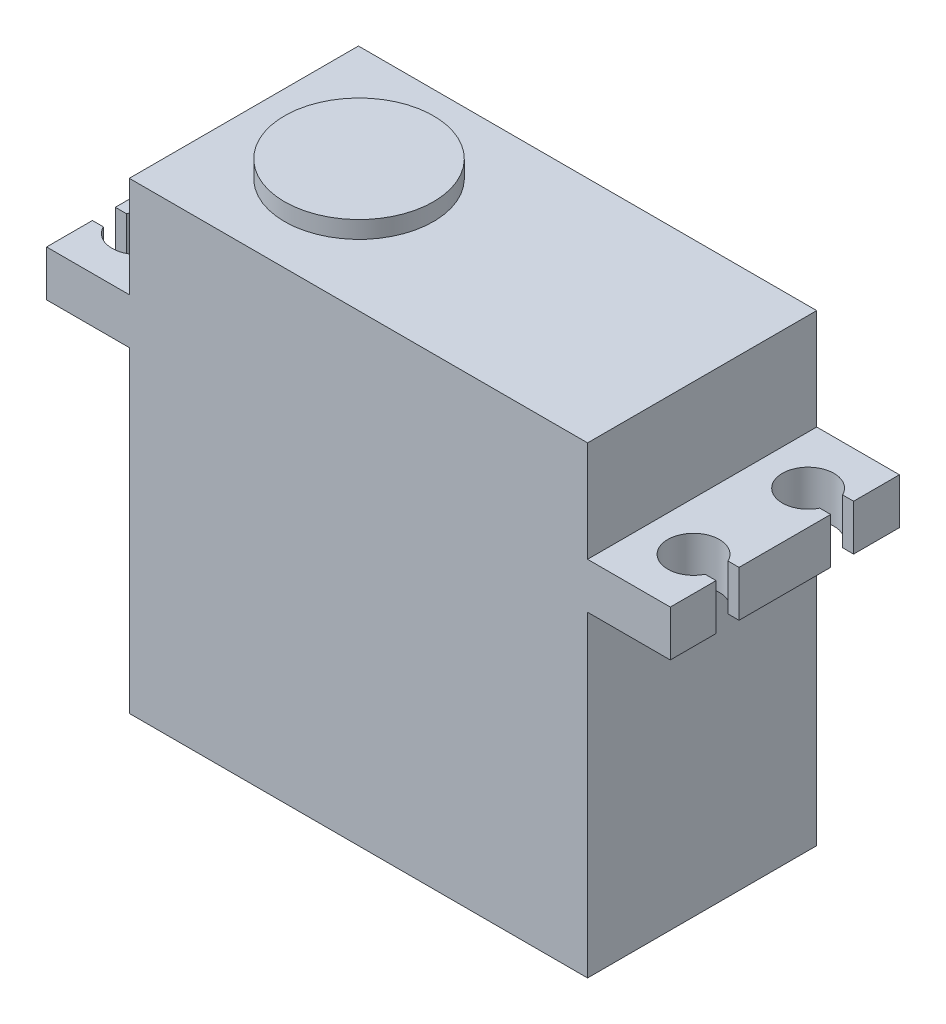
from build123d import *

# Parameters (mm, degrees)
SKETCH2_W             = 40
SKETCH2_H             = 20
BOSS_EXTRUDE1_DEPTH   = 27.65
SKETCH3_W             = 7
SKETCH3_H             = 4
BOSS_EXTRUDE2_DEPTH   = 5
SKETCH5_W             = 40
SKETCH5_H             = 20
BOSS_EXTRUDE5_DEPTH   = 12.8
SKETCH7_W             = 20
SKETCH7_H             = 4
BOSS_EXTRUDE6_DEPTH   = 7.22
CUT_EXTRUDE3_DEPTH    = 4
MIRROR11_COPY_1_DEPTH = 4
SKETCH9_R             = 6.5
BOSS_EXTRUDE8_DEPTH   = 1.5


with BuildPart() as part:
    # Sketch2 → Boss-Extrude1 (new body)
    with BuildSketch(Plane(origin=(0, 0, 0), x_dir=(1, 0, 0), z_dir=(0, 1, 0))):
        Rectangle(SKETCH2_W, SKETCH2_H)
    extrude(amount=BOSS_EXTRUDE1_DEPTH)

    # Sketch3 → Boss-Extrude2 (add)
    with BuildSketch(Plane.ZY.offset(20)):
        with Locations((0, 6)):
            Rectangle(SKETCH3_W, SKETCH3_H)
    extrude(amount=BOSS_EXTRUDE2_DEPTH)

    # Sketch5 → Boss-Extrude5 (add)
    with BuildSketch(Plane(origin=(0, 27.65, 0), x_dir=(1, 0, 0), z_dir=(0, 1, 0))):
        Rectangle(SKETCH5_W, SKETCH5_H)
    extrude(amount=BOSS_EXTRUDE5_DEPTH)

    # Sketch7 → Boss-Extrude6 (add)
    with BuildSketch(Plane.ZY.offset(20)):
        with Locations((0, 29.65)):
            Rectangle(SKETCH7_W, SKETCH7_H)
    boss_extrude6 = extrude(amount=BOSS_EXTRUDE6_DEPTH)

    # Sketch8 → Cut-Extrude3 (cut)
    with BuildSketch(Plane(origin=(0, 31.65, 0), x_dir=(1, 0, 0), z_dir=(0, 1, 0))):
        with BuildLine():
            Line((-26.265564437, 6), (-27.22, 6))
            Line((-27.22, 6), (-27.22, 4))
            Line((-27.22, 4), (-26.265564437, 4))
            ThreePointArc((-26.265564437, 4), (-22, 5), (-26.265564437, 6))
        make_face()
    cut_extrude3 = extrude(amount=-CUT_EXTRUDE3_DEPTH, mode=Mode.SUBTRACT)

    # Mirror10: Cut-Extrude3 across plane
    add(cut_extrude3.mirror(Plane.XY), mode=Mode.SUBTRACT)

    # Mirror11: Boss-Extrude6, Cut-Extrude3 across plane
    add(boss_extrude6.mirror(Plane(origin=(0, 0, 0), x_dir=(0, 0, 1), z_dir=(1, 0, 0))))
    add(cut_extrude3.mirror(Plane(origin=(0, 0, 0), x_dir=(0, 0, 1), z_dir=(1, 0, 0))), mode=Mode.SUBTRACT)

    # Mirror11 copy 1 sketch → Mirror11 copy 1 (cut)
    with BuildSketch(Plane(origin=(0, 31.65, 0), x_dir=(-1, 0, 0), z_dir=(0, 1, 0))):
        with BuildLine():
            Line((-26.265564437, 6), (-27.22, 6))
            Line((-27.22, 6), (-27.22, 4))
            Line((-27.22, 4), (-26.265564437, 4))
            ThreePointArc((-26.265564437, 4), (-22, 5), (-26.265564437, 6))
        make_face()
    extrude(amount=-MIRROR11_COPY_1_DEPTH, mode=Mode.SUBTRACT)

    # Sketch9 → Boss-Extrude8 (add)
    with BuildSketch(Plane(origin=(0, 40.45, 0), x_dir=(1, 0, 0), z_dir=(0, 1, 0))):
        with Locations((-9.95, 0)):
            Circle(SKETCH9_R)
    extrude(amount=BOSS_EXTRUDE8_DEPTH)


solid = part.part
